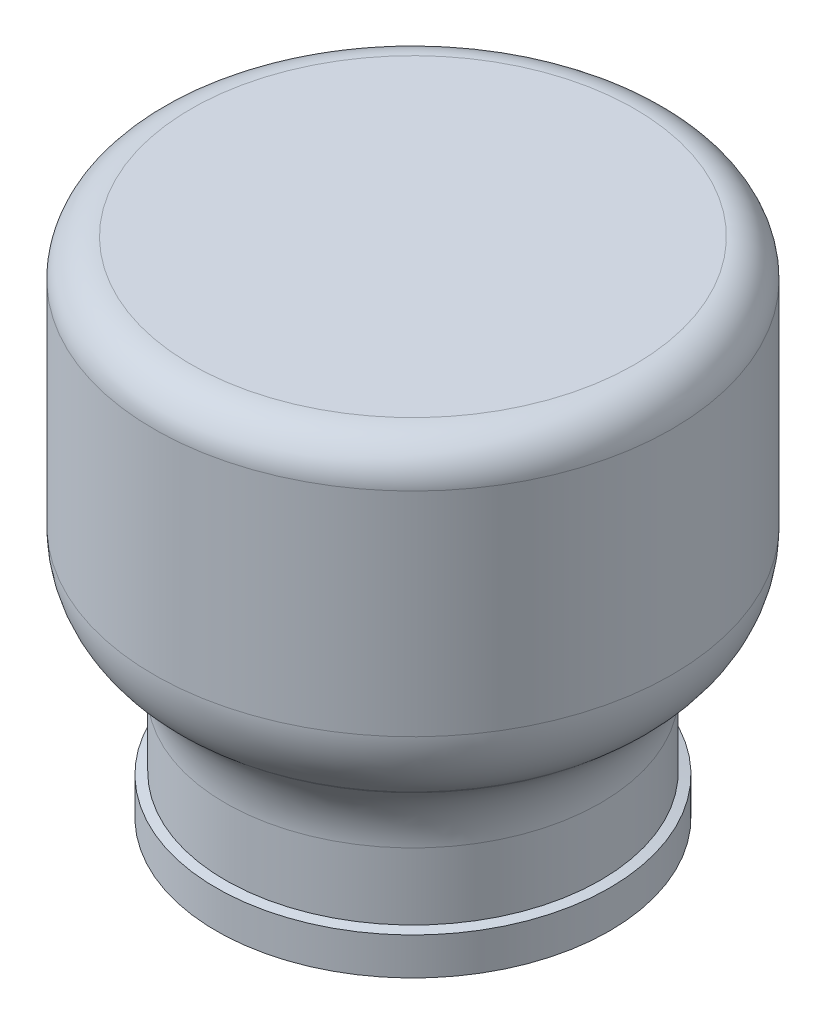
from build123d import *

# Parameters (mm, degrees)
SKETCH4_R           = 10
BOSS_EXTRUDE2_DEPTH = 6


with BuildPart() as part:
    # Sketch1 → Revolve1 (revolve)
    with BuildSketch(Plane.XY):
        with BuildLine():
            Line((20.9, 0), (23.871591838, 0))
            Line((23.871591838, 0), (23.871591838, 4))
            Line((23.871591838, 4), (22.9, 4.236662843))
            Line((22.9, 4.236662843), (22.9, 11.404308102))
            ThreePointArc((22.9, 11.404308102), (23.83692213, 15.63049072), (26.472123903, 19.064752533))
            Line((26.472123903, 19.064752533), (26.988320528, 19.497892931))
            ThreePointArc((26.988320528, 19.497892931), (29.623522302, 22.932154745), (30.560444431, 27.158337362))
            Line((30.560444431, 27.158337362), (30.560444431, 50))
            ThreePointArc((30.560444431, 50), (29.388871556, 52.828427125), (26.560444431, 54))
            Line((26.560444431, 54), (2.764914955, 54))
            Line((2.764914955, 54), (2.764914955, 52))
            Line((2.764914955, 52), (26.560444431, 52))
            ThreePointArc((26.560444431, 52), (27.974657994, 51.414213562), (28.560444431, 50))
            Line((28.560444431, 50), (28.560444431, 28.090952678))
            ThreePointArc((28.560444431, 28.090952678), (27.623522302, 23.864770061), (24.988320528, 20.430508247))
            Line((24.988320528, 20.430508247), (23.688173754, 19.339555569))
            ThreePointArc((23.688173754, 19.339555569), (20.680499091, 17.603073792), (17.260297657, 17))
            Line((17.260297657, 17), (2.764914955, 17))
            Line((2.764914955, 17), (2.764914955, 15))
            Line((2.764914955, 15), (19.9, 15))
            ThreePointArc((19.9, 15), (20.607106781, 14.707106781), (20.9, 14))
            Line((20.9, 14), (20.9, 0))
        make_face()
    revolve(axis=Axis((2.764914955, 7.821821657, 0), (0, 1, 0)))


with BuildPart() as body_2:
    # Sketch4 → Boss-Extrude2 (new body)
    with BuildSketch(Plane.XY.offset(22.9)):
        with Locations((1.144629865, 39)):
            Circle(SKETCH4_R)
    extrude(amount=-BOSS_EXTRUDE2_DEPTH)


solid = Compound([part.part, body_2.part])
